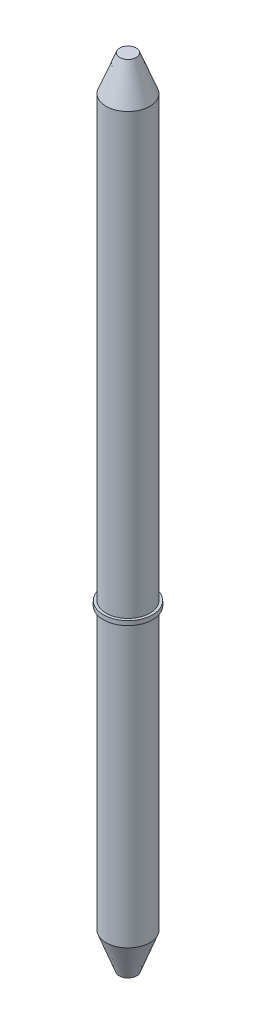
from build123d import *

# Parameters (mm, degrees)
SKETCH1_R           = 63.5
BOSS_EXTRUDE1_DEPTH = 812.8
SKETCH2_R           = 71.128555951
BOSS_EXTRUDE2_DEPTH = 12.7
SKETCH3_R           = 63.5
BOSS_EXTRUDE3_DEPTH = 1270


with BuildPart() as part:
    # Sketch1 → Boss-Extrude1 (new body)
    with BuildSketch(Plane(origin=(0, 0, 0), x_dir=(1, 0, 0), z_dir=(0, 1, 0))):
        Circle(SKETCH1_R)
    extrude(amount=BOSS_EXTRUDE1_DEPTH)

    # Sketch2 → Boss-Extrude2 (add)
    with BuildSketch(Plane(origin=(0, 812.8, 0), x_dir=(1, 0, 0), z_dir=(0, 1, 0))):
        Circle(SKETCH2_R)
    extrude(amount=BOSS_EXTRUDE2_DEPTH)

    # Sketch3 → Boss-Extrude3 (add)
    with BuildSketch(Plane(origin=(0, 825.5, 0), x_dir=(1, 0, 0), z_dir=(0, 1, 0))):
        Circle(SKETCH3_R)
    extrude(amount=BOSS_EXTRUDE3_DEPTH)

    # Sketch4 → Revolve1 (revolve)
    with BuildSketch(Plane(origin=(0, 0, 0), x_dir=(0, 0, -1), z_dir=(1, 0, 0))):
        Polygon((63.5, 2095.5), (0, 2095.5), (0, 2197.891995707), (23.870095604, 2197.891995707), align=None)
    revolve(axis=Axis((0, 2095.5, 0), (0, 1, 0)))

    # Sketch5 → Revolve2 (revolve)
    with BuildSketch(Plane(origin=(0, 0, 0), x_dir=(0, 0, -1), z_dir=(1, 0, 0))):
        Polygon((-63.5, 0), (0, 0), (0, -102.21935002), (-25.448214397, -102.21935002), align=None)
    revolve(axis=Axis((0, 0, 0), (0, -1, 0)))


solid = part.part
